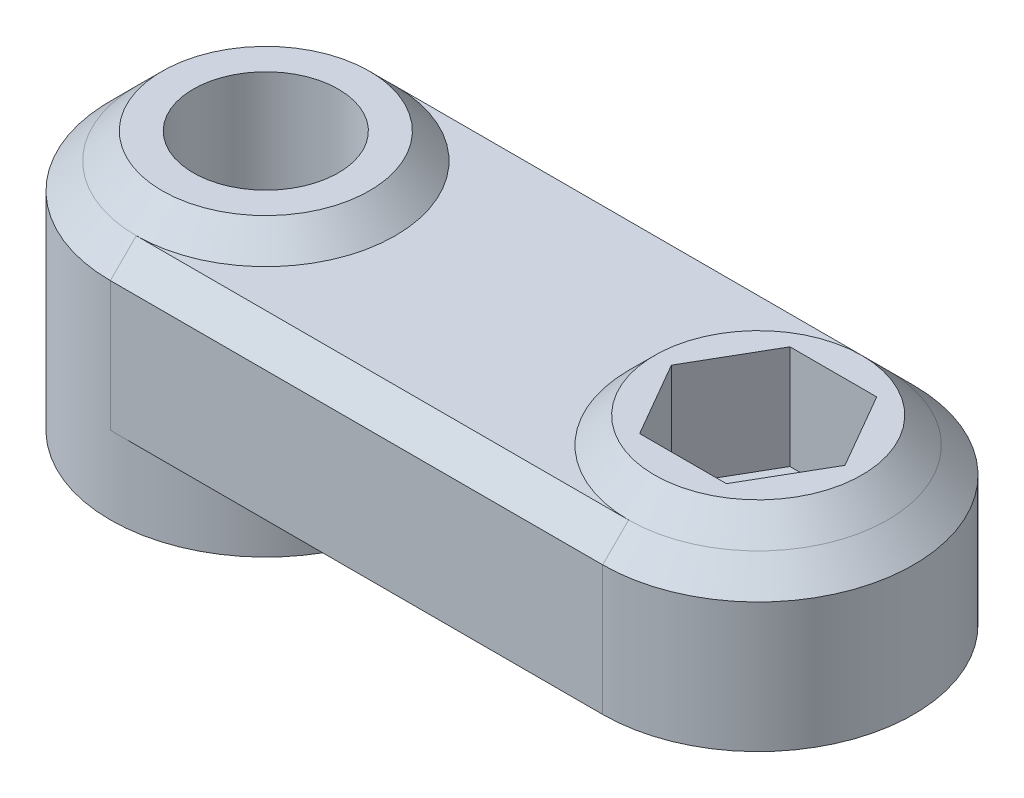
from build123d import *

# Parameters (mm, degrees)
EXTRUDE_1_DEPTH     = 10
CHAMFER_1_SIZE      = 2
CUT_EXTRUDE_1_DEPTH = 5
SKETCH_5_R          = 32.43595028
SKETCH_5_R_2        = 6
CUT_EXTRUDE_2_DEPTH = 3
CUT_EXTRUDE_3_DEPTH = 4
SKETCH_7_W          = 54.061660739
SKETCH_7_H          = 47.527586942
SKETCH_7_R          = 4
CUT_EXTRUDE_4_DEPTH = 1
CHAMFER_2_SIZE      = 1


with BuildPart() as part:
    # 草图1 → 凸台-拉伸1 (new body)
    with BuildSketch(Plane(origin=(0, 0, 0), x_dir=(1, 0, 0), z_dir=(0, 1, 0))):
        with BuildLine():
            Line((0, 6), (19, 6))
            ThreePointArc((19, 6), (25, 0), (19, -6))
            Line((19, -6), (0, -6))
            ThreePointArc((0, -6), (-6, 0), (0, 6))
        make_face()
    extrude(amount=EXTRUDE_1_DEPTH)

    # 草图2 → 切除-旋转1 (revolve, cut)
    with BuildSketch(Plane.XY, mode=Mode.PRIVATE) as cut_revolve_1_sk:
        Polygon((0, 10), (-2.8, 10), (-2.8, 5), (-1.85, 5), (-1.85, 2), (-2.8, 2), (-2.8, 0), (0, 0), align=None)
    revolve(cut_revolve_1_sk.sketch.rotate(Axis((0, -1.427566958, 0), (0, 1, 0)), 270), axis=Axis((0, -1.427566958, 0), (0, 1, 0)), mode=Mode.SUBTRACT)

    # 草图3 → 切除-旋转2 (revolve, cut)
    with BuildSketch(Plane.XY, mode=Mode.PRIVATE) as cut_revolve_2_sk:
        Polygon((19, 0), (16.675, 0), (16.675, 6), (16.25, 6), (16.25, 10), (19, 10), align=None)
    revolve(cut_revolve_2_sk.sketch.rotate(Axis((19, 0, 0), (0, 1, 0)), 270), axis=Axis((19, 0, 0), (0, 1, 0)), mode=Mode.SUBTRACT)

    # 倒角1
    chamfer_1_edges = [part.edges().sort_by_distance(p)[0] for p in [
        (25, 10, 0),
        (9.5, 10, -6),
        (-6, 10, 0),
        (9.5, 10, 6),
    ]]
    chamfer(chamfer_1_edges, length=CHAMFER_1_SIZE)

    # 草图4 → 切除-拉伸1 (cut)
    with BuildSketch(Plane.XZ):
        Polygon((2.107328483, 3.65), (-2.107328483, 3.65), (-4.214656965, 0), (-2.107328483, -3.65), (2.107328483, -3.65), (4.214656965, 0), align=None)
    extrude(amount=-CUT_EXTRUDE_1_DEPTH, mode=Mode.SUBTRACT)

    # 草图5 → 切除-拉伸2 (cut)
    with BuildSketch(Plane.XZ):
        Circle(SKETCH_5_R)
        with Locations(Location((0, 0, 0), (0, 0, 90))):
            Circle(SKETCH_5_R_2, mode=Mode.SUBTRACT)
    extrude(amount=-CUT_EXTRUDE_2_DEPTH, mode=Mode.SUBTRACT)

    # 草图6 → 切除-拉伸3 (cut)
    with BuildSketch(Plane(origin=(0, 10, 0), x_dir=(1, 0, 0), z_dir=(0, 1, 0))):
        Polygon((20.674315781, 2.9), (17.325684219, 2.9), (15.651368439, 0), (17.325684219, -2.9), (20.674315781, -2.9), (22.348631561, 0), align=None)
    extrude(amount=-CUT_EXTRUDE_3_DEPTH, mode=Mode.SUBTRACT)

    # 草图7 → 切除-拉伸4 (cut)
    with BuildSketch(Plane(origin=(0, 10, 0), x_dir=(1, 0, 0), z_dir=(0, 1, 0))):
        with Locations((6.682015694, 1.141108586)):
            Rectangle(SKETCH_7_W, SKETCH_7_H)
        with Locations(Location((0, 0, 0), (0, 0, 270))):
            Circle(SKETCH_7_R, mode=Mode.SUBTRACT)
        with Locations(Location((19, 0, 0), (0, 0, 270))):
            Circle(SKETCH_7_R, mode=Mode.SUBTRACT)
    extrude(amount=-CUT_EXTRUDE_4_DEPTH, mode=Mode.SUBTRACT)

    # 倒角2
    chamfer_2_edges = [part.edges().sort_by_distance(p)[0] for p in [
        (19, 9, -4),
        (0, 9, -4),
    ]]
    chamfer(chamfer_2_edges, length=CHAMFER_2_SIZE - 0.0001)  # a hair under: the kernel refuses the full size


solid = part.part
